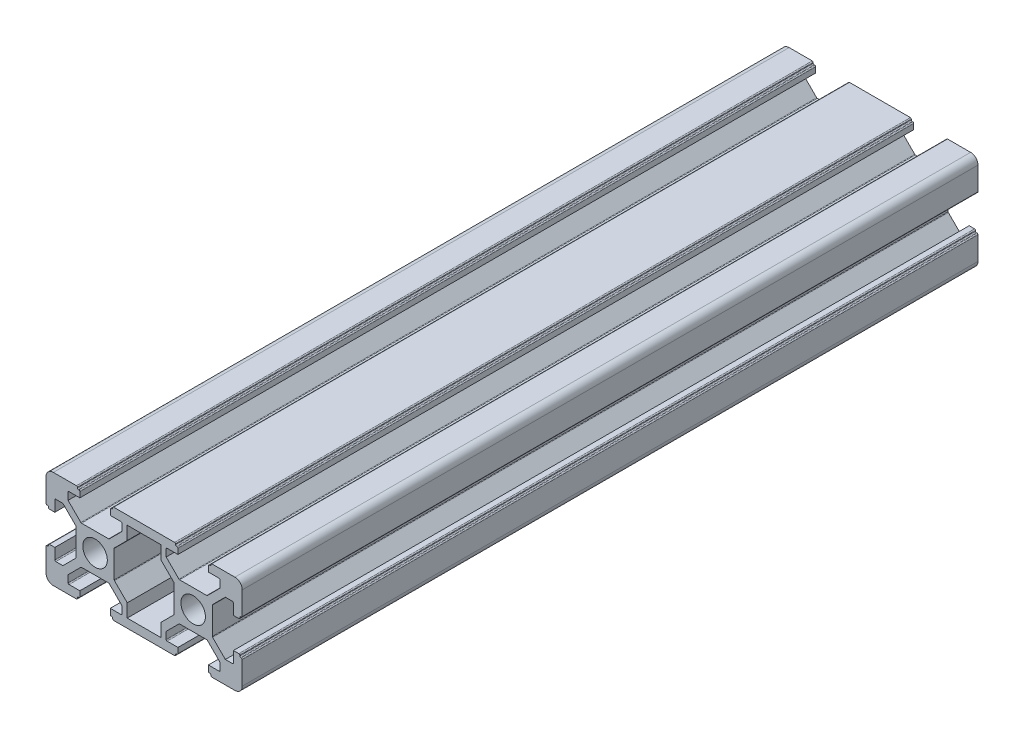
from build123d import *

# Parameters (mm, degrees)
BOSS_EXTRUDE1_DEPTH = 150
SKETCH2_R           = 2.5
CUT_EXTRUDE1_DEPTH  = 154.297097168
SKETCH4_R           = 1.5
CUT_EXTRUDE3_DEPTH  = 30


with BuildPart() as part:
    # Sketch1 → Boss-Extrude1 (new body)
    with BuildSketch(Plane.XY):
        with BuildLine():
            Line((-8.5, 10), (-3.8, 10))
            ThreePointArc((-3.8, 10), (-3.658578644, 9.941421356), (-3.6, 9.8))
            Line((-3.6, 9.8), (-3.6, 9.7))
            ThreePointArc((-3.6, 9.7), (-3.541421356, 9.558578644), (-3.4, 9.5))
            Line((-3.4, 9.5), (-3.3, 9.5))
            ThreePointArc((-3.3, 9.5), (-3.158578644, 9.441421356), (-3.1, 9.3))
            Line((-3.1, 9.3), (-3.1, 8.2))
            Line((-3.1, 8.2), (-5.3, 8.2))
            ThreePointArc((-5.3, 8.2), (-5.441421356, 8.141421356), (-5.5, 8))
            Line((-5.5, 8), (-5.5, 6.560660172))
            Line((-5.5, 6.560660172), (-2.897918472, 3.958578644))
            ThreePointArc((-2.897918472, 3.958578644), (-2.833033802, 3.915224093), (-2.756497116, 3.9))
            Line((-2.756497116, 3.9), (2.756497116, 3.9))
            ThreePointArc((2.756497116, 3.9), (2.833033802, 3.915224093), (2.897918472, 3.958578644))
            Line((2.897918472, 3.958578644), (5.5, 6.560660172))
            Line((5.5, 6.560660172), (5.5, 8))
            ThreePointArc((5.5, 8), (5.441421356, 8.141421356), (5.3, 8.2))
            Line((5.3, 8.2), (3.1, 8.2))
            Line((3.1, 8.2), (3.1, 9.3))
            ThreePointArc((3.1, 9.3), (3.158578644, 9.441421356), (3.3, 9.5))
            Line((3.3, 9.5), (3.4, 9.5))
            ThreePointArc((3.4, 9.5), (3.541421356, 9.558578644), (3.6, 9.7))
            Line((3.6, 9.7), (3.6, 9.8))
            ThreePointArc((3.6, 9.8), (3.658578644, 9.941421356), (3.8, 10))
            Line((3.8, 10), (8.5, 10))
            Line((8.5, 10), (11.5, 10))
            Line((11.5, 10), (16.2, 10))
            ThreePointArc((16.2, 10), (16.341421356, 9.941421356), (16.4, 9.8))
            Line((16.4, 9.8), (16.4, 9.7))
            ThreePointArc((16.4, 9.7), (16.458578644, 9.558578644), (16.6, 9.5))
            Line((16.6, 9.5), (16.7, 9.5))
            ThreePointArc((16.7, 9.5), (16.841421356, 9.441421356), (16.9, 9.3))
            Line((16.9, 9.3), (16.9, 8.2))
            Line((16.9, 8.2), (14.7, 8.2))
            ThreePointArc((14.7, 8.2), (14.558578644, 8.141421356), (14.5, 8))
            Line((14.5, 8), (14.5, 6.560660172))
            Line((14.5, 6.560660172), (17.102081528, 3.958578644))
            ThreePointArc((17.102081528, 3.958578644), (17.166966198, 3.915224093), (17.243502884, 3.9))
            Line((17.243502884, 3.9), (22.756497116, 3.9))
            ThreePointArc((22.756497116, 3.9), (22.833033802, 3.915224093), (22.897918472, 3.958578644))
            Line((22.897918472, 3.958578644), (25.5, 6.560660172))
            Line((25.5, 6.560660172), (25.5, 8))
            ThreePointArc((25.5, 8), (25.441421356, 8.141421356), (25.3, 8.2))
            Line((25.3, 8.2), (23.1, 8.2))
            Line((23.1, 8.2), (23.1, 9.3))
            ThreePointArc((23.1, 9.3), (23.158578644, 9.441421356), (23.3, 9.5))
            Line((23.3, 9.5), (23.4, 9.5))
            ThreePointArc((23.4, 9.5), (23.541421356, 9.558578644), (23.6, 9.7))
            Line((23.6, 9.7), (23.6, 9.8))
            ThreePointArc((23.6, 9.8), (23.658578644, 9.941421356), (23.8, 10))
            Line((23.8, 10), (28.5, 10))
            ThreePointArc((28.5, 10), (29.560660172, 9.560660172), (30, 8.5))
            Line((30, 8.5), (30, 3.8))
            ThreePointArc((30, 3.8), (29.941421356, 3.658578644), (29.8, 3.6))
            Line((29.8, 3.6), (29.7, 3.6))
            ThreePointArc((29.7, 3.6), (29.558578644, 3.541421356), (29.5, 3.4))
            Line((29.5, 3.4), (29.5, 3.3))
            ThreePointArc((29.5, 3.3), (29.441421356, 3.158578644), (29.3, 3.1))
            Line((29.3, 3.1), (28.2, 3.1))
            Line((28.2, 3.1), (28.2, 5.3))
            ThreePointArc((28.2, 5.3), (28.141421356, 5.441421356), (28, 5.5))
            Line((28, 5.5), (26.560660172, 5.5))
            Line((26.560660172, 5.5), (23.958578644, 2.897918472))
            ThreePointArc((23.958578644, 2.897918472), (23.915224093, 2.833033802), (23.9, 2.756497116))
            Line((23.9, 2.756497116), (23.9, -2.756497116))
            ThreePointArc((23.9, -2.756497116), (23.915224093, -2.833033802), (23.958578644, -2.897918472))
            Line((23.958578644, -2.897918472), (26.560660172, -5.5))
            Line((26.560660172, -5.5), (28, -5.5))
            ThreePointArc((28, -5.5), (28.141421356, -5.441421356), (28.2, -5.3))
            Line((28.2, -5.3), (28.2, -3.1))
            Line((28.2, -3.1), (29.3, -3.1))
            ThreePointArc((29.3, -3.1), (29.441421356, -3.158578644), (29.5, -3.3))
            Line((29.5, -3.3), (29.5, -3.4))
            ThreePointArc((29.5, -3.4), (29.558578644, -3.541421356), (29.7, -3.6))
            Line((29.7, -3.6), (29.8, -3.6))
            ThreePointArc((29.8, -3.6), (29.941421356, -3.658578644), (30, -3.8))
            Line((30, -3.8), (30, -8.5))
            ThreePointArc((30, -8.5), (29.560660172, -9.560660172), (28.5, -10))
            Line((28.5, -10), (23.8, -10))
            ThreePointArc((23.8, -10), (23.658578644, -9.941421356), (23.6, -9.8))
            Line((23.6, -9.8), (23.6, -9.7))
            ThreePointArc((23.6, -9.7), (23.541421356, -9.558578644), (23.4, -9.5))
            Line((23.4, -9.5), (23.3, -9.5))
            ThreePointArc((23.3, -9.5), (23.158578644, -9.441421356), (23.1, -9.3))
            Line((23.1, -9.3), (23.1, -8.2))
            Line((23.1, -8.2), (25.3, -8.2))
            ThreePointArc((25.3, -8.2), (25.441421356, -8.141421356), (25.5, -8))
            Line((25.5, -8), (25.5, -6.560660172))
            Line((25.5, -6.560660172), (22.897918472, -3.958578644))
            ThreePointArc((22.897918472, -3.958578644), (22.833033802, -3.915224093), (22.756497116, -3.9))
            Line((22.756497116, -3.9), (17.243502884, -3.9))
            ThreePointArc((17.243502884, -3.9), (17.166966198, -3.915224093), (17.102081528, -3.958578644))
            Line((17.102081528, -3.958578644), (14.5, -6.560660172))
            Line((14.5, -6.560660172), (14.5, -8))
            ThreePointArc((14.5, -8), (14.558578644, -8.141421356), (14.7, -8.2))
            Line((14.7, -8.2), (16.9, -8.2))
            Line((16.9, -8.2), (16.9, -9.3))
            ThreePointArc((16.9, -9.3), (16.841421356, -9.441421356), (16.7, -9.5))
            Line((16.7, -9.5), (16.6, -9.5))
            ThreePointArc((16.6, -9.5), (16.458578644, -9.558578644), (16.4, -9.7))
            Line((16.4, -9.7), (16.4, -9.8))
            ThreePointArc((16.4, -9.8), (16.341421356, -9.941421356), (16.2, -10))
            Line((16.2, -10), (11.5, -10))
            Line((11.5, -10), (8.5, -10))
            Line((8.5, -10), (3.8, -10))
            ThreePointArc((3.8, -10), (3.658578644, -9.941421356), (3.6, -9.8))
            Line((3.6, -9.8), (3.6, -9.7))
            ThreePointArc((3.6, -9.7), (3.541421356, -9.558578644), (3.4, -9.5))
            Line((3.4, -9.5), (3.3, -9.5))
            ThreePointArc((3.3, -9.5), (3.158578644, -9.441421356), (3.1, -9.3))
            Line((3.1, -9.3), (3.1, -8.2))
            Line((3.1, -8.2), (5.3, -8.2))
            ThreePointArc((5.3, -8.2), (5.441421356, -8.141421356), (5.5, -8))
            Line((5.5, -8), (5.5, -6.560660172))
            Line((5.5, -6.560660172), (2.897918472, -3.958578644))
            ThreePointArc((2.897918472, -3.958578644), (2.833033802, -3.915224093), (2.756497116, -3.9))
            Line((2.756497116, -3.9), (-2.756497116, -3.9))
            ThreePointArc((-2.756497116, -3.9), (-2.833033802, -3.915224093), (-2.897918472, -3.958578644))
            Line((-2.897918472, -3.958578644), (-5.5, -6.560660172))
            Line((-5.5, -6.560660172), (-5.5, -8))
            ThreePointArc((-5.5, -8), (-5.441421356, -8.141421356), (-5.3, -8.2))
            Line((-5.3, -8.2), (-3.1, -8.2))
            Line((-3.1, -8.2), (-3.1, -9.3))
            ThreePointArc((-3.1, -9.3), (-3.158578644, -9.441421356), (-3.3, -9.5))
            Line((-3.3, -9.5), (-3.4, -9.5))
            ThreePointArc((-3.4, -9.5), (-3.541421356, -9.558578644), (-3.6, -9.7))
            Line((-3.6, -9.7), (-3.6, -9.8))
            ThreePointArc((-3.6, -9.8), (-3.658578644, -9.941421356), (-3.8, -10))
            Line((-3.8, -10), (-8.5, -10))
            ThreePointArc((-8.5, -10), (-9.560660172, -9.560660172), (-10, -8.5))
            Line((-10, -8.5), (-10, -3.8))
            ThreePointArc((-10, -3.8), (-9.941421356, -3.658578644), (-9.8, -3.6))
            Line((-9.8, -3.6), (-9.7, -3.6))
            ThreePointArc((-9.7, -3.6), (-9.558578644, -3.541421356), (-9.5, -3.4))
            Line((-9.5, -3.4), (-9.5, -3.3))
            ThreePointArc((-9.5, -3.3), (-9.441421356, -3.158578644), (-9.3, -3.1))
            Line((-9.3, -3.1), (-8.2, -3.1))
            Line((-8.2, -3.1), (-8.2, -5.3))
            ThreePointArc((-8.2, -5.3), (-8.141421356, -5.441421356), (-8, -5.5))
            Line((-8, -5.5), (-6.560660172, -5.5))
            Line((-6.560660172, -5.5), (-3.958578644, -2.897918472))
            ThreePointArc((-3.958578644, -2.897918472), (-3.915224093, -2.833033802), (-3.9, -2.756497116))
            Line((-3.9, -2.756497116), (-3.9, 2.756497116))
            ThreePointArc((-3.9, 2.756497116), (-3.915224093, 2.833033802), (-3.958578644, 2.897918472))
            Line((-3.958578644, 2.897918472), (-6.560660172, 5.5))
            Line((-6.560660172, 5.5), (-8, 5.5))
            ThreePointArc((-8, 5.5), (-8.141421356, 5.441421356), (-8.2, 5.3))
            Line((-8.2, 5.3), (-8.2, 3.1))
            Line((-8.2, 3.1), (-9.3, 3.1))
            ThreePointArc((-9.3, 3.1), (-9.441421356, 3.158578644), (-9.5, 3.3))
            Line((-9.5, 3.3), (-9.5, 3.4))
            ThreePointArc((-9.5, 3.4), (-9.558578644, 3.541421356), (-9.7, 3.6))
            Line((-9.7, 3.6), (-9.8, 3.6))
            ThreePointArc((-9.8, 3.6), (-9.941421356, 3.658578644), (-10, 3.8))
            Line((-10, 3.8), (-10, 8.5))
            ThreePointArc((-10, 8.5), (-9.560660172, 9.560660172), (-8.5, 10))
        make_face()
        with BuildLine():
            Line((3.9, 2.756497116), (3.9, -2.756497116))
            ThreePointArc((3.9, -2.756497116), (3.915224093, -2.833033802), (3.958578644, -2.897918472))
            Line((3.958578644, -2.897918472), (6.560660172, -5.5))
            Line((6.560660172, -5.5), (6.560660172, -8.2))
            Line((6.560660172, -8.2), (13.439339828, -8.2))
            Line((13.439339828, -8.2), (13.439339828, -5.5))
            Line((13.439339828, -5.5), (16.041421356, -2.897918472))
            ThreePointArc((16.041421356, -2.897918472), (16.084775907, -2.833033802), (16.1, -2.756497116))
            Line((16.1, -2.756497116), (16.1, 2.756497116))
            ThreePointArc((16.1, 2.756497116), (16.084775907, 2.833033802), (16.041421356, 2.897918472))
            Line((16.041421356, 2.897918472), (13.439339828, 5.5))
            Line((13.439339828, 5.5), (13.439339828, 8.2))
            Line((13.439339828, 8.2), (6.560660172, 8.2))
            Line((6.560660172, 8.2), (6.560660172, 5.5))
            Line((6.560660172, 5.5), (3.958578644, 2.897918472))
            ThreePointArc((3.958578644, 2.897918472), (3.915224093, 2.833033802), (3.9, 2.756497116))
        make_face(mode=Mode.SUBTRACT)
    extrude(amount=BOSS_EXTRUDE1_DEPTH)

    # Sketch2 → Cut-Extrude1 (cut, through all)
    with BuildSketch(Plane.XY.offset(150)):
        Circle(SKETCH2_R)
        with Locations((20, 0)):
            Circle(SKETCH2_R)
    extrude(amount=-CUT_EXTRUDE1_DEPTH, mode=Mode.SUBTRACT)

    # Sketch4 → Cut-Extrude3 (cut)
    with BuildSketch(Plane(origin=(0, 3.9, 0), x_dir=(1, 0, 0), z_dir=(0, 1, 0))):
        with Locations((0, -133.3)):
            Circle(SKETCH4_R)
        with Locations((0, -116.6)):
            Circle(SKETCH4_R)
        with Locations((20, -116.6)):
            Circle(SKETCH4_R)
        with Locations((20, -133.3)):
            Circle(SKETCH4_R)
    extrude(amount=-CUT_EXTRUDE3_DEPTH, mode=Mode.SUBTRACT)


solid = part.part
